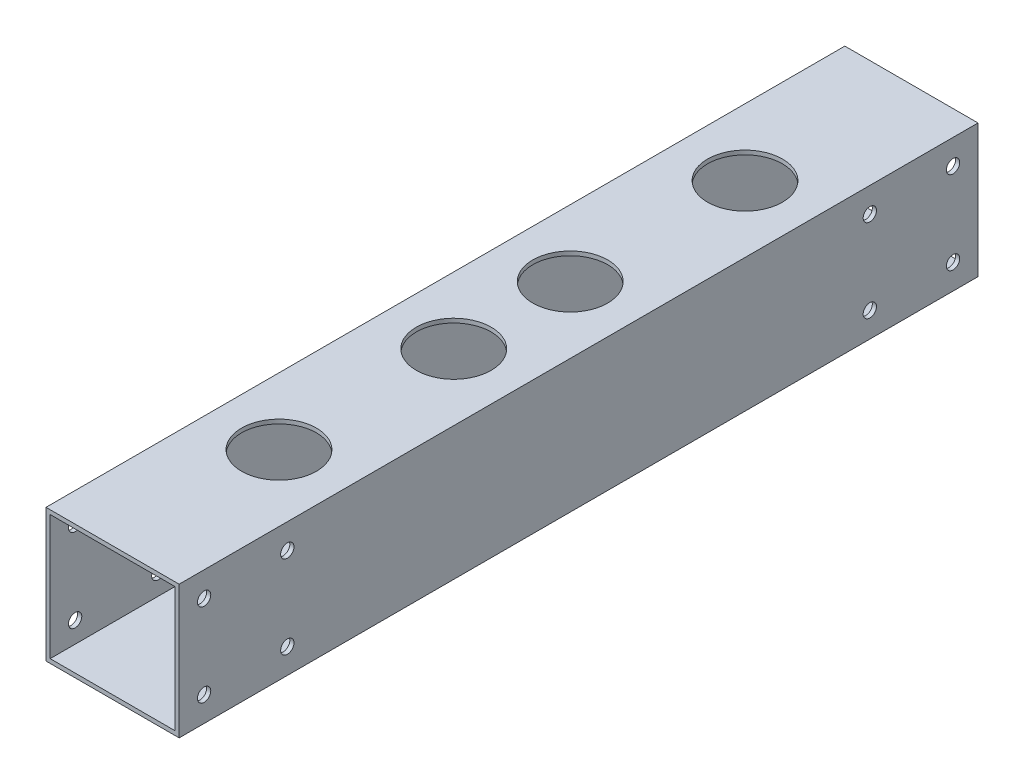
from build123d import *

# Parameters (mm, degrees)
SKETCH2_W               = 50.8
SKETCH2_H               = 50.8
SKETCH2_W_2             = 47.625
SKETCH2_H_2             = 47.625
BOSS_EXTRUDE1_DEPTH     = 152.4
SKETCH3_R               = 14.2875
CUT_EXTRUDE1_DEPTH      = 163.639355631
CUT_EXTRUDE2_DEPTH      = 163.639355631
CUT_EXTRUDE2_DEPTH_BACK = 163.639355631
SKETCH4_R               = 2.54


with BuildPart() as part:
    # Sketch2 → Boss-Extrude1 (new, symmetric)
    with BuildSketch(Plane.XY):
        Rectangle(SKETCH2_W, SKETCH2_H)
        Rectangle(SKETCH2_W_2, SKETCH2_H_2, mode=Mode.SUBTRACT)
    extrude(amount=BOSS_EXTRUDE1_DEPTH, both=True)

    # Sketch3 → Cut-Extrude1 (cut, through all)
    with BuildSketch(Plane(origin=(0, 25.4, 0), x_dir=(1, 0, 0), z_dir=(0, 1, 0))):
        with Locations((0, -88.9)):
            Circle(SKETCH3_R)
        with Locations((0, -22.225)):
            Circle(SKETCH3_R)
        with Locations((0, 22.225)):
            Circle(SKETCH3_R)
        with Locations((0, 88.9)):
            Circle(SKETCH3_R)
    extrude(amount=-CUT_EXTRUDE1_DEPTH, mode=Mode.SUBTRACT)

    # Sketch4 → Cut-Extrude2 (cut, two sides: drawn at the far end of the back side and taken through both)
    with BuildSketch(Plane.ZY.offset(25.4).offset(-CUT_EXTRUDE2_DEPTH_BACK)):
        with Locations((-142.875, 15.875)):
            Circle(SKETCH4_R)
        with Locations((-142.875, -15.875)):
            Circle(SKETCH4_R)
        with Locations((-111.125, 15.875)):
            Circle(SKETCH4_R)
        with Locations((-111.125, -15.875)):
            Circle(SKETCH4_R)
        with Locations((111.125, -15.875)):
            Circle(SKETCH4_R)
        with Locations((111.125, 15.875)):
            Circle(SKETCH4_R)
        with Locations((142.875, -15.875)):
            Circle(SKETCH4_R)
        with Locations((142.875, 15.875)):
            Circle(SKETCH4_R)
    extrude(amount=CUT_EXTRUDE2_DEPTH + CUT_EXTRUDE2_DEPTH_BACK, mode=Mode.SUBTRACT)


solid = part.part
